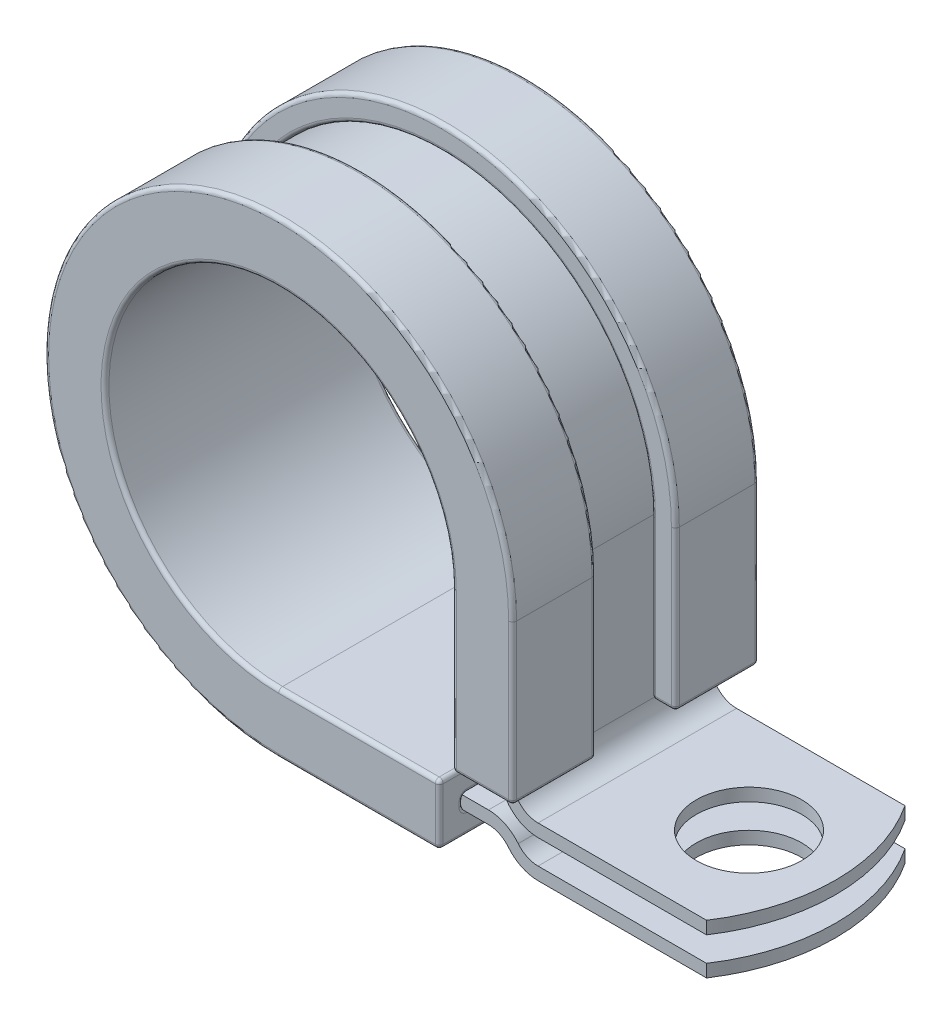
from build123d import *

# Parameters (mm, degrees)
BOSS_EXTRUDE1_DEPTH         = 6.35
SKETCH2_R                   = 3.3734375
CUT_EXTRUDE1_DEPTH          = 33.17548697
CUT_EXTRUDE3_DEPTH          = 33.17548697
CUT_EXTRUDE3_DEPTH_BACK     = 33.17548697
BOSS_EXTRUDE2_DEPTH         = 7.874
BOSS_EXTRUDE2_DEPTH_BACK    = 7.874
BODY_MOVE_COPY1_START       = -10.1473
BODY_MOVE_COPY1_OUTLINE_W   = 0.8128
BODY_MOVE_COPY1_OUTLINE_H   = 12.7
BODY_MOVE_COPY1_DEPTH       = 10.1473
BODY_MOVE_COPY1_START_2     = -13.5509
BODY_MOVE_COPY1_2_OUTLINE_W = 0.8128
BODY_MOVE_COPY1_2_OUTLINE_H = 12.7
BODY_MOVE_COPY1_2_DEPTH     = 0.1016
BODY_MOVE_COPY1_START_3     = -12.5857
BODY_MOVE_COPY1_3_OUTLINE_R = 3.3734375
BODY_MOVE_COPY1_3_DEPTH     = 2.4384
BODY_MOVE_COPY1_START_4     = -14.9733
BODY_MOVE_COPY1_4_OUTLINE_R = 3.3734375
BODY_MOVE_COPY1_4_DEPTH     = 2.3368
BODY_MOVE_COPY1_5_OUTLINE_W = 0.8128
BODY_MOVE_COPY1_5_OUTLINE_H = 12.7
BODY_MOVE_COPY1_5_DEPTH     = 12.6365
BODY_MOVE_COPY1_START_5     = -6.35
BODY_MOVE_COPY1_6_DEPTH     = 12.7
BODY_MOVE_COPY1_7_DEPTH     = 12.7
CUT_EXTRUDE4_DEPTH          = 2.54
CUT_EXTRUDE4_DEPTH_BACK     = 2.54
FILLET1_R                   = 0.254


with BuildPart() as part:
    # Sketch1 → Boss-Extrude1 (new, symmetric)
    with BuildSketch(Plane.XY):
        with BuildLine():
            Line((0, -12.6365), (11.902441017, -12.6365))
            ThreePointArc((11.902441017, -12.6365), (12.958299189, -12.876955942), (13.805916407, -13.5509))
            ThreePointArc((13.805916407, -13.5509), (14.370994552, -14.000196038), (15.0749, -14.1605))
            Line((15.0749, -14.1605), (27.7622, -14.1605))
            Line((27.7622, -14.1605), (27.7622, -14.9733))
            Line((27.7622, -14.9733), (15.0749, -14.9733))
            ThreePointArc((15.0749, -14.9733), (14.019041828, -14.732844058), (13.17142461, -14.0589))
            ThreePointArc((13.17142461, -14.0589), (12.606346465, -13.609603962), (11.902441017, -13.4493))
            Line((11.902441017, -13.4493), (0, -13.4493))
            ThreePointArc((0, -13.4493), (-9.510091232, 9.510091232), (13.4493, 0))
            Line((13.4493, 0), (13.4493, -10.1473))
            ThreePointArc((13.4493, -10.1473), (13.925427217, -11.296772783), (15.0749, -11.7729))
            Line((15.0749, -11.7729), (27.7622, -11.7729))
            Line((27.7622, -11.7729), (27.7622, -12.5857))
            Line((27.7622, -12.5857), (15.0749, -12.5857))
            ThreePointArc((15.0749, -12.5857), (13.350690825, -11.871509175), (12.6365, -10.1473))
            Line((12.6365, -10.1473), (12.6365, 0))
            ThreePointArc((12.6365, 0), (-8.93535484, 8.93535484), (0, -12.6365))
        make_face()
    extrude(amount=BOSS_EXTRUDE1_DEPTH, both=True)

    # Sketch2 → Cut-Extrude1 (cut, through all)
    with BuildSketch(Plane(origin=(0, 0, 0), x_dir=(1, 0, 0), z_dir=(0, 1, 0))):
        with Locations(Location((22.225, 0, 0), (0, 0, 270))):
            Circle(SKETCH2_R)
    extrude(amount=-CUT_EXTRUDE1_DEPTH, mode=Mode.SUBTRACT)

    # Sketch4 → Cut-Extrude3 (cut, two sides: drawn at the far end of the back side and taken through both)
    with BuildSketch(Plane(origin=(0, 0, 0), x_dir=(1, 0, 0), z_dir=(0, 1, 0)).offset(-CUT_EXTRUDE3_DEPTH_BACK)):
        with BuildLine():
            Line((-25.123285896, 83.67040361), (25.8572, 6.35))
            ThreePointArc((25.8572, 6.35), (27.7622, 0), (25.8572, -6.35))
            Line((25.8572, -6.35), (-25.123285896, -83.67040361))
            Line((-25.123285896, -83.67040361), (160.10581286, -83.67040361))
            Line((160.10581286, -83.67040361), (160.10581286, 83.67040361))
            Line((160.10581286, 83.67040361), (-25.123285896, 83.67040361))
        make_face()
    extrude(amount=CUT_EXTRUDE3_DEPTH + CUT_EXTRUDE3_DEPTH_BACK, mode=Mode.SUBTRACT)


with BuildPart() as body_2:
    # Sketch5 → Boss-Extrude2 (new, two sides: drawn at the far end of the back side and taken through both)
    with BuildSketch(Plane.XY.offset(-BOSS_EXTRUDE2_DEPTH_BACK)):
        with BuildLine():
            Line((11.1125, 0), (11.1125, -10.1473))
            Line((11.1125, -10.1473), (14.9733, -10.1473))
            Line((14.9733, -10.1473), (14.9733, 0))
            ThreePointArc((14.9733, 0), (-10.587721967, 10.587721967), (0, -14.9733))
            Line((0, -14.9733), (10.276841017, -14.9733))
            Line((10.276841017, -14.9733), (10.276841017, -11.1125))
            Line((10.276841017, -11.1125), (0, -11.1125))
            ThreePointArc((0, -11.1125), (-7.857724106, 7.857724106), (11.1125, 0))
        make_face()
    extrude(amount=BOSS_EXTRUDE2_DEPTH + BOSS_EXTRUDE2_DEPTH_BACK)


with BuildPart() as body_3:
    # Body-Move/Copy1: read off the stored shape, not the designer's step
    # Body-Move/Copy1 outline → Body-Move/Copy1 (new body)
    with BuildSketch(Plane(origin=(0, 0, 0), x_dir=(1, 0, 0), z_dir=(0, 1, 0)).offset(BODY_MOVE_COPY1_START)):
        with Locations((13.0429, 0)):
            Rectangle(BODY_MOVE_COPY1_OUTLINE_W, BODY_MOVE_COPY1_OUTLINE_H)
    extrude(amount=BODY_MOVE_COPY1_DEPTH)

    # Body-Move_Copy1 2 outline → Body-Move_Copy1 2 (add)
    with BuildSketch(Plane(origin=(0, 0, 0), x_dir=(1, 0, 0), z_dir=(0, 1, 0)).offset(BODY_MOVE_COPY1_START_2)):
        with Locations((13.0429, 0)):
            Rectangle(BODY_MOVE_COPY1_2_OUTLINE_W, BODY_MOVE_COPY1_2_OUTLINE_H)
    extrude(amount=BODY_MOVE_COPY1_2_DEPTH)

    # Body-Move_Copy1 3 outline → Body-Move_Copy1 3 (add)
    with BuildSketch(Plane(origin=(0, 0, 0), x_dir=(1, 0, 0), z_dir=(0, 1, 0)).offset(BODY_MOVE_COPY1_START_3)):
        with BuildLine():
            ThreePointArc((25.8572, -6.35), (27.7622, 0), (25.8572, 6.35))
            Line((25.8572, 6.35), (12.6365, 6.35))
            Line((12.6365, 6.35), (12.6365, -6.35))
            Line((12.6365, -6.35), (25.8572, -6.35))
        make_face()
        with Locations((22.225, 0)):
            Circle(BODY_MOVE_COPY1_3_OUTLINE_R, mode=Mode.SUBTRACT)
    extrude(amount=BODY_MOVE_COPY1_3_DEPTH)

    # Body-Move_Copy1 4 outline → Body-Move_Copy1 4 (add)
    with BuildSketch(Plane(origin=(0, 0, 0), x_dir=(1, 0, 0), z_dir=(0, 1, 0)).offset(BODY_MOVE_COPY1_START_4)):
        with BuildLine():
            ThreePointArc((25.8572, -6.35), (27.7622, 0), (25.8572, 6.35))
            Line((25.8572, 6.35), (12.6365, 6.35))
            Line((12.6365, 6.35), (12.6365, -6.35))
            Line((12.6365, -6.35), (25.8572, -6.35))
        make_face()
        with Locations((22.225, 0)):
            Circle(BODY_MOVE_COPY1_4_OUTLINE_R, mode=Mode.SUBTRACT)
    extrude(amount=BODY_MOVE_COPY1_4_DEPTH)

    # Body-Move_Copy1 5 outline → Body-Move_Copy1 5 (add)
    with BuildSketch(Plane(origin=(0, 0, 0), x_dir=(1, 0, 0), z_dir=(0, 1, 0))):
        with Locations((13.0429, 0)):
            Rectangle(BODY_MOVE_COPY1_5_OUTLINE_W, BODY_MOVE_COPY1_5_OUTLINE_H)
    extrude(amount=BODY_MOVE_COPY1_5_DEPTH)

    # Body-Move_Copy1 6 outline → Body-Move_Copy1 6 (cut)
    with BuildSketch(Plane.XY.offset(BODY_MOVE_COPY1_START_5)):
        with BuildLine():
            ThreePointArc((13.4493, -10.1473), (13.925427217, -11.296772783), (15.0749, -11.7729))
            Line((15.0749, -11.7729), (29, -11.7729))
            Line((29, -11.7729), (29, -10.1473))
            Line((29, -10.1473), (13.4493, -10.1473))
        make_face()
        with BuildLine():
            ThreePointArc((12.636499997, 4.604621407), (13.244541327, 2.337904091), (13.4493, 0))
            Line((13.4493, 0), (13.4493, 12.6365))
            Line((13.4493, 12.6365), (12.6365, 12.6365))
            Line((12.6365, 12.6365), (12.636499997, 4.604621407))
        make_face()
        with BuildLine():
            Line((12.6365, -12.5857), (15.0749, -12.5857))
            ThreePointArc((15.0749, -12.5857), (13.350690825, -11.871509175), (12.6365, -10.1473))
            Line((12.6365, -10.1473), (12.6365, -12.5857))
        make_face()
        with BuildLine():
            Line((29, -14.1605), (29, -12.6365))
            Line((29, -12.6365), (12.6365, -12.6365))
            Line((12.6365, -12.6365), (12.6365, -12.749614647))
            ThreePointArc((12.6365, -12.749614647), (13.28072308, -13.063399785), (13.805916407, -13.5509))
            ThreePointArc((13.805916407, -13.5509), (14.370994552, -14.000196038), (15.0749, -14.1605))
            Line((15.0749, -14.1605), (29, -14.1605))
        make_face()
        with BuildLine():
            ThreePointArc((13.17142461, -14.0589), (12.927246446, -13.813016807), (12.6365, -13.62447497))
            Line((12.6365, -13.62447497), (12.6365, -14.9733))
            Line((12.6365, -14.9733), (15.0749, -14.9733))
            ThreePointArc((15.0749, -14.9733), (14.019041828, -14.732844058), (13.17142461, -14.0589))
        make_face()
    extrude(amount=BODY_MOVE_COPY1_6_DEPTH, mode=Mode.SUBTRACT)

    # Body-Move_Copy1 7 outline → Body-Move_Copy1 7 (add)
    with BuildSketch(Plane.XY.offset(BODY_MOVE_COPY1_START_5)):
        with BuildLine():
            Line((12.6365, 0), (12.636499997, 4.604621407))
            ThreePointArc((12.636499997, 4.604621407), (-11.018452822, 7.712157149), (0, -13.4493))
            Line((0, -13.4493), (11.902441017, -13.4493))
            ThreePointArc((11.902441017, -13.4493), (12.279776697, -13.493700094), (12.6365, -13.62447497))
            Line((12.6365, -13.62447497), (12.6365, -12.749614647))
            ThreePointArc((12.6365, -12.749614647), (12.273802537, -12.664944568), (11.902441017, -12.6365))
            Line((11.902441017, -12.6365), (0, -12.6365))
            ThreePointArc((0, -12.6365), (-8.93535484, 8.93535484), (12.6365, 0))
        make_face()
    extrude(amount=BODY_MOVE_COPY1_7_DEPTH)


with BuildPart() as body_2_1:
    add(body_2.part)

    # Combine1: cut body 3
    add(body_3.part, mode=Mode.SUBTRACT)

    # Sketch7 → Cut-Extrude4 (cut, two sides: drawn at the far end of the back side and taken through both)
    with BuildSketch(Plane.XY.offset(-CUT_EXTRUDE4_DEPTH_BACK)):
        with BuildLine():
            Line((12.6365, 0), (12.6365, -10.1473))
            Line((12.6365, -10.1473), (14.9733, -10.1473))
            Line((14.9733, -10.1473), (14.9733, 0))
            ThreePointArc((14.9733, 0), (-10.587721967, 10.587721967), (0, -14.9733))
            Line((0, -14.9733), (10.276841017, -14.9733))
            Line((10.276841017, -14.9733), (10.276841017, -12.6365))
            Line((10.276841017, -12.6365), (0, -12.6365))
            ThreePointArc((0, -12.6365), (-8.93535484, 8.93535484), (12.6365, 0))
        make_face()
    extrude(amount=CUT_EXTRUDE4_DEPTH + CUT_EXTRUDE4_DEPTH_BACK, mode=Mode.SUBTRACT)

    # Fillet1
    fillet1_edges = [body_2_1.edges().sort_by_distance(p)[0] for p in [
        (13.4493, -10.1473, -4.445),
        (10.276841017, -13.4493, -4.445),
        (14.9733, -10.1473, -5.207),
        (10.276841017, -14.9733, -5.207),
        (5.138420508, -13.4493, -2.54),
        (-11.018452822, 7.712157149, -2.54),
        (13.4493, -5.07365, -2.54),
        (10.276841017, -14.2113, -2.54),
        (10.276841017, -14.2113, 2.54),
        (5.138420508, -14.9733, 2.54),
        (5.138420508, -14.9733, -2.54),
        (-10.587721967, 10.587721967, 2.54),
        (-10.587721967, 10.587721967, -2.54),
        (14.9733, -5.07365, 2.54),
        (14.9733, -5.07365, -2.54),
        (14.2113, -10.1473, 2.54),
        (14.2113, -10.1473, -2.54),
        (5.138420508, -13.4493, 2.54),
        (-11.018452822, 7.712157149, 2.54),
        (13.4493, -5.07365, 2.54),
        (10.276841017, -11.1125, 0),
        (5.138420508, -11.1125, 7.874),
        (10.276841017, -14.9733, 5.207),
        (14.9733, -10.1473, 5.207),
        (11.1125, -10.1473, 0),
        (10.276841017, -13.0429, 7.874),
        (5.138420508, -14.9733, 7.874),
        (-10.587721967, 10.587721967, 7.874),
        (14.9733, -5.07365, 7.874),
        (13.0429, -10.1473, 7.874),
        (11.1125, -5.07365, 7.874),
        (-7.857724106, 7.857724106, 7.874),
        (11.1125, -5.07365, -7.874),
        (13.0429, -10.1473, -7.874),
        (14.9733, -5.07365, -7.874),
        (-10.587721967, 10.587721967, -7.874),
        (5.138420508, -14.9733, -7.874),
        (10.276841017, -13.0429, -7.874),
        (5.138420508, -11.1125, -7.874),
        (-7.857724106, 7.857724106, -7.874),
        (13.0429, -10.1473, -6.35),
        (13.0429, -10.1473, 6.35),
        (10.276841017, -12.6365, 0),
        (10.276841017, -13.4493, 4.445),
        (5.138420508, -13.4493, -6.35),
        (5.138420508, -12.6365, -6.35),
        (5.138420508, -12.6365, 6.35),
        (-8.93535484, 8.93535484, 6.35),
        (12.6365, -5.07365, 6.35),
        (13.4493, -5.07365, 6.35),
        (-11.018452822, 7.712157149, 6.35),
        (5.138420508, -13.4493, 6.35),
        (10.276841017, -13.0429, 6.35),
        (10.276841017, -13.0429, -6.35),
        (12.6365, -10.1473, 0),
        (13.4493, -5.07365, -6.35),
        (13.4493, -10.1473, 4.445),
        (-11.018452822, 7.712157149, -6.35),
        (-8.93535484, 8.93535484, -6.35),
        (12.6365, -5.07365, -6.35),
    ]]
    fillet(fillet1_edges, radius=FILLET1_R)


solid = Compound([part.part, body_2_1.part])
